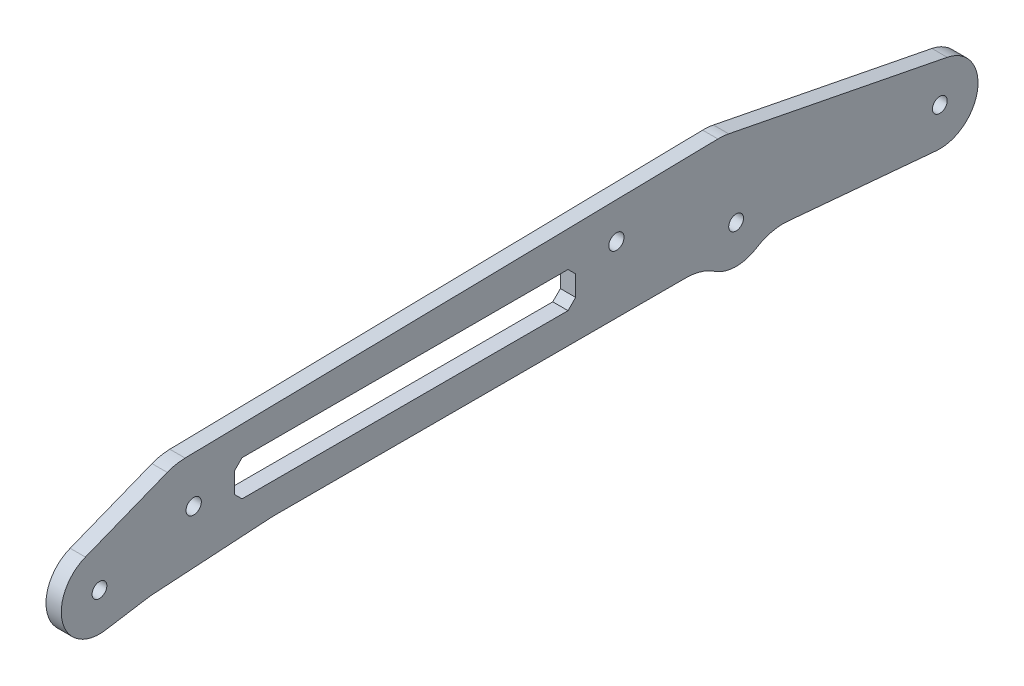
from build123d import *

# Parameters (mm, degrees)
SKETCH1_R           = 1.45
SKETCH1_R_2         = 1.5
BOSS_EXTRUDE1_DEPTH = 1.5
FILLET1_R           = 10


with BuildPart() as part:
    # Sketch1 → Boss-Extrude1 (new, symmetric)
    with BuildSketch(Plane(origin=(0, 0, 0), x_dir=(0, 0, -1), z_dir=(1, 0, 0))):
        with BuildLine():
            Line((-110, 14), (-127.759109434, 6.974045822))
            ThreePointArc((-127.759109434, 6.974045822), (-132.233383985, -1.981957648), (-123.818844483, -7.406407472))
            Line((-123.818844483, -7.406407472), (-115, -6))
            Line((-115, -6), (-91, -4.5))
            Line((-91, -4.5), (-6, -4.5))
            ThreePointArc((-6, -4.5), (0, -7.5), (6, -4.5))
            Line((6, -4.5), (39.334317565, -7.47039938))
            ThreePointArc((39.334317565, -7.47039938), (47.425031601, -1.057783404), (41.446954522, 7.359097948))
            Line((41.446954522, 7.359097948), (-2.5, 16))
            Line((-2.5, 16), (-110, 14))
        make_face()
        with Locations((-125, 0)):
            Circle(SKETCH1_R, mode=Mode.SUBTRACT)
        Circle(SKETCH1_R, mode=Mode.SUBTRACT)
        with Locations((-106.5, 5)):
            Circle(SKETCH1_R_2, mode=Mode.SUBTRACT)
        Polygon((-33, 8.5), (-31.5, 7), (-31.5, 3), (-33, 1.5), (-97, 1.5), (-98.5, 3), (-98.5, 7), (-97, 8.5), align=None, mode=Mode.SUBTRACT)
        with Locations((-23.5, 8.5)):
            Circle(SKETCH1_R_2, mode=Mode.SUBTRACT)
        with Locations((40, 0)):
            Circle(SKETCH1_R, mode=Mode.SUBTRACT)
    extrude(amount=BOSS_EXTRUDE1_DEPTH, both=True)

    # Fillet1
    # the kernel refuses this fillet: 10 mm, written as the material it adds along each edge
    with BuildSketch(Plane(origin=(-1.5, -4.5, -6), x_dir=(0, -0.08875765800116116, -0.9960532506578896), z_dir=(1, 0, 0))) as fillet1_piece_1:
        with BuildLine():
            CenterArc((4.191013496, -10), FILLET1_R, 90, 37.143535998)
            ThreePointArc((-1.847125053, -2.028746469), (-0.83000341, -1.099556568), (0, 0))
            Line((0, 0), (4.191013496, 0))
        make_face()
    extrude(amount=3)
    with BuildSketch(Plane(origin=(-1.5, -4.5, 6), x_dir=(0, -0.689479455343069, -0.7243052399781633), z_dir=(1, 0, 0))) as fillet1_piece_2:
        with BuildLine():
            CenterArc((4.143912969, -9.861667083), FILLET1_R, 99.541184992, 34.04773237)
            Line((-2.750881584, -2.618614683), (0, 0))
            ThreePointArc((0, 0), (1.243173891, -0.103749688), (2.486347782, 0))
        make_face()
    extrude(amount=3)
    with BuildSketch(Plane(origin=(-1.5, -4.5, 91), x_dir=(0, 0, -1), z_dir=(1, 0, 0))) as fillet1_piece_3:
        with BuildLine():
            CenterArc((FILLET1_R * 0.0312195418814, -FILLET1_R), FILLET1_R, 90, 3.576334375)
            Line((-FILLET1_R * 0.0311587442738, -FILLET1_R * 0.00194742151711), (0, 0))
            Line((0, 0), (FILLET1_R * 0.0312195418814, 0))
        make_face()
    extrude(amount=3)
    with BuildSketch(Plane(origin=(-1.5, -6, 115), x_dir=(0, 0.06237828615518053, -0.9980525784828885), z_dir=(1, 0, 0))) as fillet1_piece_4:
        with BuildLine():
            CenterArc((FILLET1_R * 0.04790007143, -FILLET1_R), FILLET1_R, 90, 5.484751657)
            Line((-FILLET1_R * 0.0476807691396, -FILLET1_R * 0.00457832909063), (0, 0))
            Line((0, 0), (FILLET1_R * 0.04790007143, 0))
        make_face()
    extrude(amount=3)
    # the kernel refuses this fillet: 10 mm, written as the material it takes off along each edge
    with BuildSketch(Plane(origin=(-6.025054026, 14, 110), x_dir=(0, 0.018601432156142118, -0.9998269783926319), z_dir=(1, 0, 0))) as fillet1_2_piece_1:
        with BuildLine():
            CenterArc((FILLET1_R * 0.181002161022, -FILLET1_R), FILLET1_R, 90, 20.51916315)
            Line((-FILLET1_R * 0.169518480088, -FILLET1_R * 0.0634449935237), (0, 0))
            Line((0, 0), (FILLET1_R * 0.181002161022, 0))
        make_face()
    extrude(amount=12.050108051, mode=Mode.SUBTRACT)
    with BuildSketch(Plane(origin=(4.169414773, 16, 2.5), x_dir=(0, -0.018601432156142392, 0.9998269783926319), z_dir=(-1, 0, 0))) as fillet1_2_piece_2:
        with BuildLine():
            CenterArc((FILLET1_R * 0.106776590902, -FILLET1_R), FILLET1_R, 90, 12.189510847)
            Line((-FILLET1_R * 0.104369266233, -FILLET1_R * 0.0225454348081), (0, 0))
            Line((0, 0), (FILLET1_R * 0.106776590902, 0))
        make_face()
    extrude(amount=8.338829545, mode=Mode.SUBTRACT)


solid = part.part
